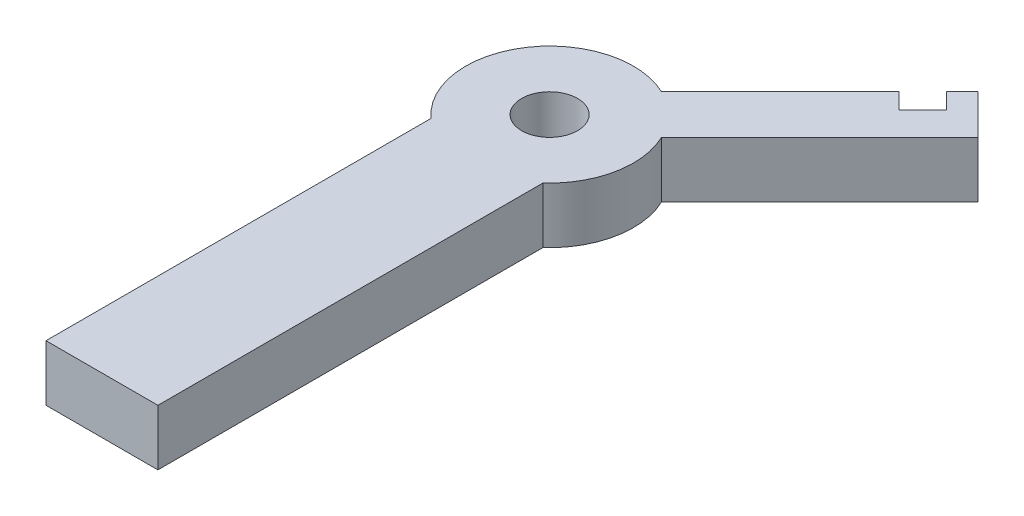
from build123d import *

# Parameters (mm, degrees)
BOSS_EXTRUDE1_DEPTH = 3.175


with BuildPart() as part:
    # Sketch1 → Boss-Extrude1 (new, symmetric)
    with BuildSketch(Plane(origin=(0, 0, 0), x_dir=(1, 0, 0), z_dir=(0, 1, 0))):
        with BuildLine():
            Line((17.575320151, 22.065448212), (4.10493597, 8.59506403))
            ThreePointArc((4.10493597, 8.59506403), (-7.92717083, 5.280680604), (-6.35, -7.099515829))
            Line((-6.35, -7.099515829), (-6.35, -50.8))
            Line((-6.35, -50.8), (6.35, -50.8))
            Line((6.35, -50.8), (6.35, -7.099515829))
            ThreePointArc((6.35, -7.099515829), (9.339361313, -1.871351185), (8.59506403, 4.10493597))
            Line((8.59506403, 4.10493597), (26.555576272, 22.065448212))
            Line((26.555576272, 22.065448212), (22.065448212, 26.555576272))
            Line((22.065448212, 26.555576272), (20.269396988, 24.759525048))
            Line((20.269396988, 24.759525048), (22.065448212, 22.963473824))
            Line((22.065448212, 22.963473824), (19.371371376, 20.269396988))
            Line((19.371371376, 20.269396988), (17.575320151, 22.065448212))
        make_face()
        with BuildLine():
            ThreePointArc((-3.175, 0), (0, 3.175), (3.175, 0))
            ThreePointArc((3.175, 0), (0, -3.175), (-3.175, 0))
        make_face(mode=Mode.SUBTRACT)
    extrude(amount=BOSS_EXTRUDE1_DEPTH, both=True)


solid = part.part
